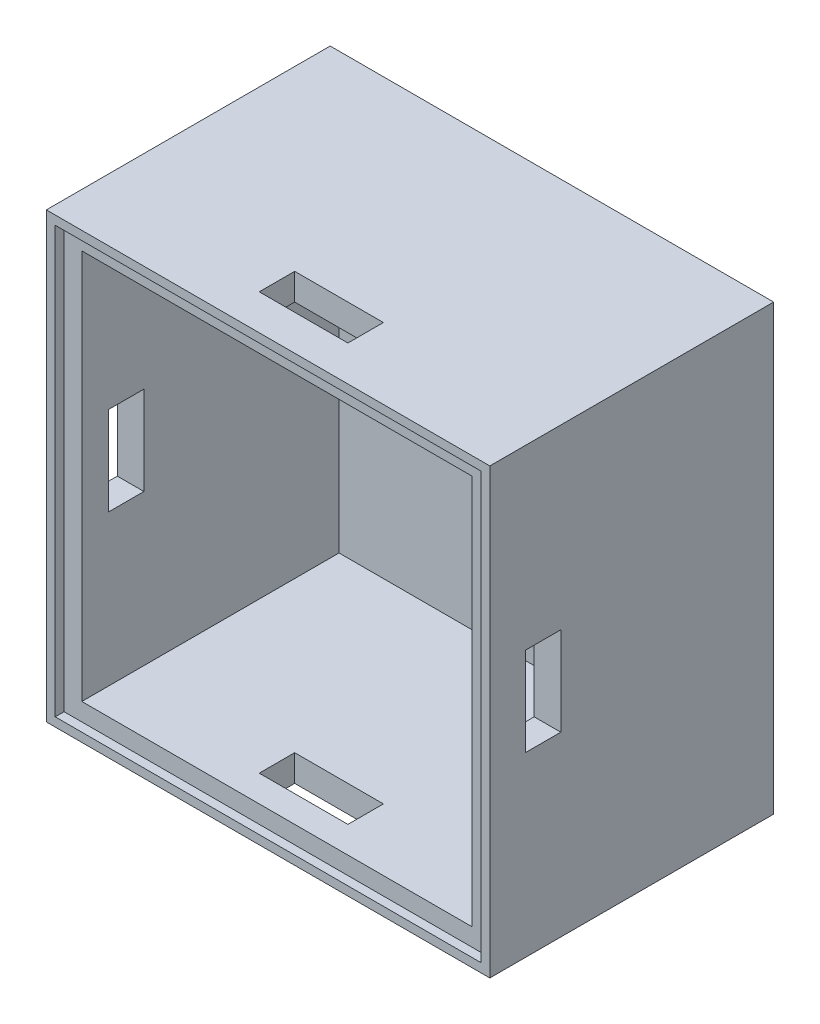
from build123d import *

# Parameters (mm, degrees)
SKETCH_1_W               = 250
SKETCH_1_H               = 250
EXTRUDE_1_DEPTH          = 10
SKETCH_2_W               = 250
SKETCH_2_H               = 250
SKETCH_2_W_2             = 215
SKETCH_2_H_2             = 215
SKETCH_2_W_3             = 100
SKETCH_2_H_3             = 100
EXTRUDE_2_DEPTH          = 5
SKETCH_3_W               = 250
SKETCH_3_H               = 250
EXTRUDE_3_DEPTH          = 150
SKETCH_4_W               = 220
SKETCH_4_H               = 220
CUT_EXTRUDE_1_DEPTH      = 150
CUT_EXTRUDE_2_DEPTH      = 4
SKETCH_6_W               = 20
SKETCH_6_H               = 50
CUT_EXTRUDE_3_DEPTH      = 323.063658392
PATTERN_CIRCULAR_1_COUNT = 2
PATTERN_CIRCULAR_1_ANGLE = 90
SKETCH_11_W              = 240
SKETCH_11_H              = 240
CUT_EXTRUDE_5_DEPTH      = 5
SKETCH_12_OUTSIDE_W      = 330.032
SKETCH_12_OUTSIDE_H      = 330.032
SKETCH_12_OUTSIDE_W_2    = 240
SKETCH_12_OUTSIDE_H_2    = 240
CUT_EXTRUDE_6_DEPTH      = 5


with BuildPart() as part:
    # 스케치1 → 보스-돌출1 (new body)
    with BuildSketch(Plane.XY):
        Rectangle(SKETCH_1_W, SKETCH_1_H)
    extrude(amount=EXTRUDE_1_DEPTH)

    # 스케치2 → 보스-돌출2 (add)
    # profile 1 of 2: a face of its own
    with BuildSketch(Plane(origin=(0, 0, 0), x_dir=(-1, 0, 0), z_dir=(0, 0, -1))):
        Rectangle(SKETCH_2_W, SKETCH_2_H)
        Rectangle(SKETCH_2_W_2, SKETCH_2_H_2, mode=Mode.SUBTRACT)
    # profile 2 of 2: a face of its own
    with BuildSketch(Plane(origin=(0, 0, 0), x_dir=(-1, 0, 0), z_dir=(0, 0, -1))):
        Rectangle(SKETCH_2_W_3, SKETCH_2_H_3)
    extrude(amount=EXTRUDE_2_DEPTH)

    # 스케치3 → 보스-돌출3 (add)
    with BuildSketch(Plane.XY.offset(10)):
        Rectangle(SKETCH_3_W, SKETCH_3_H)
    extrude(amount=EXTRUDE_3_DEPTH)

    # 스케치4 → 컷-돌출1 (cut)
    with BuildSketch(Plane.XY.offset(160)):
        Rectangle(SKETCH_4_W, SKETCH_4_H)
    extrude(amount=-CUT_EXTRUDE_1_DEPTH, mode=Mode.SUBTRACT)

    # 스케치5 → 컷-돌출2 (cut)
    # profile 1 of 5: a face of its own
    with BuildSketch(Plane.ZY.offset(125)):
        with BuildLine():
            Line((77.392628205, 22.435897436), (75.525641026, 22.435897436))
            add(Edge.make_bspline(
                [(75.525641026, 22.435897436), (75.593931724, 22.605833317), (75.72354889, 22.928375151), (75.864489606, 23.404034443), (75.955550979, 23.841342063), (75.968327804, 24.122221436), (75.974358974, 24.254807692)],
                knots=[0, 0, 0, 0, 1.16548392, 2.212112691, 3.15604595, 4, 4, 4, 4], degree=3))
            add(Edge.make_bspline(
                [(75.974358974, 24.254807692), (75.970864839, 24.345752162), (75.964199902, 24.519225488), (75.925218452, 24.769131304), (75.853834802, 24.993592875), (75.753223237, 25.191566325), (75.632624333, 25.356347622), (75.509867583, 25.497978146), (75.371671179, 25.600426101), (75.243075668, 25.656863123), (75.123489273, 25.689205945), (75.002595994, 25.707548077), (74.851509867, 25.723142892), (74.668299902, 25.73379682), (74.456062555, 25.746708668), (74.211586805, 25.754173156), (73.937781357, 25.758109754), (73.744125509, 25.757520417), (73.642628205, 25.757211538)],
                knots=[0, 0, 0, 0, 1.331337761, 2.539479194, 3.689133603, 4.76427039, 5.773050173, 6.672319311, 7.497143179, 8.267115508, 8.712803499, 9.307232687, 10.054035057, 10.93549937, 11.992541252, 13.16587524, 14.514601941, 16, 16, 16, 16], degree=3))
            Line((73.642628205, 25.757211538), (71.615384615, 25.757211538))
            Line((71.615384615, 25.757211538), (71.615384615, 22.692307692))
            Line((71.615384615, 22.692307692), (69.820512821, 22.692307692))
            Line((69.820512821, 22.692307692), (69.820512821, 25.761217949))
            Line((69.820512821, 25.761217949), (57, 25.769230769))
            Line((57, 25.769230769), (57, 27.564102564))
            Line((57, 27.564102564), (69.820512821, 27.564102564))
            Line((69.820512821, 27.564102564), (69.820512821, 29.615384615))
            Line((69.820512821, 29.615384615), (71.615384615, 29.615384615))
            Line((71.615384615, 29.615384615), (71.615384615, 27.564102564))
            Line((71.615384615, 27.564102564), (73.951121795, 27.564102564))
            add(Edge.make_bspline(
                [(73.951121795, 27.564102564), (74.080664429, 27.56327837), (74.329126954, 27.561697568), (74.687354287, 27.551282212), (75.017227229, 27.525938047), (75.318131846, 27.495835015), (75.590657751, 27.454677111), (75.834890799, 27.408937757), (76.050534461, 27.349458077), (76.297741006, 27.258095207), (76.576425073, 27.117370914), (76.87313611, 26.892034316), (77.13488374, 26.617074643), (77.359489756, 26.293858548), (77.543390261, 25.930465861), (77.677961701, 25.527419159), (77.752146306, 25.086860334), (77.763411834, 24.781252008), (77.769230769, 24.623397436)],
                knots=[0, 0, 0, 0, 1.116513312, 2.14147041, 3.087800047, 3.967380394, 4.74708145, 5.462637805, 6.107702186, 6.672153689, 7.732558719, 8.784560146, 9.867280226, 10.991243744, 12.164851891, 13.365962584, 14.639451828, 16, 16, 16, 16], degree=3))
            add(Edge.make_bspline(
                [(77.769230769, 24.623397436), (77.763841125, 24.462947128), (77.752570335, 24.127414448), (77.680318266, 23.600783009), (77.559215325, 23.031360271), (77.449630943, 22.639652757), (77.392628205, 22.435897436)],
                knots=[0, 0, 0, 0, 0.864748747, 1.808357173, 2.859968543, 4, 4, 4, 4], degree=3))
        make_face()
    # profile 2 of 5: a face of its own
    with BuildSketch(Plane.ZY.offset(125)):
        with BuildLine():
            Line((71.615384615, 20.384615385), (71.615384615, 18.58974359))
            Line((71.615384615, 18.58974359), (69.463942308, 18.58974359))
            add(Edge.make_bspline(
                [(69.463942308, 18.58974359), (69.664282285, 18.457252316), (70.047430935, 18.203863785), (70.553840724, 17.782440494), (70.975004156, 17.350905968), (71.306808729, 16.903893527), (71.557336266, 16.445140025), (71.742381372, 15.982273847), (71.849943483, 15.505706569), (71.864501319, 15.184809572), (71.871794872, 15.024038462)],
                knots=[0, 0, 0, 0, 1.280622107, 2.44917983, 3.507334186, 4.490567186, 5.408878616, 6.288712897, 7.142636019, 8, 8, 8, 8], degree=3))
            add(Edge.make_bspline(
                [(71.871794872, 15.024038462), (71.865144055, 14.899276185), (71.851528837, 14.643869132), (71.751080843, 14.256062761), (71.596795289, 13.854855829), (71.448158055, 13.595948984), (71.37099359, 13.461538462)],
                knots=[0, 0, 0, 0, 0.90119973, 1.844890732, 2.881183062, 4, 4, 4, 4], degree=3))
            Line((71.37099359, 13.461538462), (69.81650641, 14.447115385))
            add(Edge.make_bspline(
                [(69.81650641, 14.447115385), (69.855022217, 14.533452648), (69.92813259, 14.697337303), (70.014658363, 14.937077681), (70.065606453, 15.158113891), (70.073324839, 15.298934225), (70.076923077, 15.364583333)],
                knots=[0, 0, 0, 0, 1.180555205, 2.24091978, 3.179933427, 4, 4, 4, 4], degree=3))
            add(Edge.make_bspline(
                [(70.076923077, 15.364583333), (70.067675851, 15.510063447), (70.048982662, 15.804150276), (69.89155254, 16.235294557), (69.647893428, 16.655556662), (69.368048526, 16.985070719), (69.103363598, 17.242163185), (68.870963309, 17.425728296), (68.61054919, 17.594227693), (68.326369318, 17.755192648), (68.013630332, 17.901859443), (67.675439676, 18.038742615), (67.311410616, 18.162507732), (67.05779618, 18.23308053), (66.927884615, 18.269230769)],
                knots=[0, 0, 0, 0, 1.135927944, 2.296268816, 3.551388088, 4.924624343, 5.663947748, 6.437790805, 7.238014523, 8.089896346, 8.992356783, 9.939655789, 10.944608424, 12, 12, 12, 12], degree=3))
            add(Edge.make_bspline(
                [(66.927884615, 18.269230769), (66.812015052, 18.296273017), (66.555372774, 18.356169541), (66.124809776, 18.4144069), (65.616103154, 18.471947003), (65.027836909, 18.512499108), (64.361480087, 18.55008792), (63.61601754, 18.57128839), (62.790684105, 18.589020621), (62.213687801, 18.589495289), (61.911858974, 18.58974359)],
                knots=[0, 0, 0, 0, 0.566838948, 1.255505196, 2.06880316, 3.007127437, 4.065329342, 5.249902469, 6.561414163, 8, 8, 8, 8], degree=3))
            Line((61.911858974, 18.58974359), (57, 18.58974359))
            Line((57, 18.58974359), (57, 20.384615385))
            Line((57, 20.384615385), (71.615384615, 20.384615385))
        make_face()
    # profile 3 of 5: a face of its own
    with BuildSketch(Plane.ZY.offset(125)):
        with BuildLine():
            add(Edge.make_bspline(
                [(71.871794872, 4.350961538), (71.86597263, 4.076718886), (71.854556638, 3.538996066), (71.731942742, 2.751618832), (71.546006599, 2.000797533), (71.284277289, 1.283311371), (70.940878213, 0.605095405), (70.525606541, -0.039905718), (70.035652736, -0.650399709), (69.656431846, -1.016230333), (69.463942308, -1.201923077)],
                knots=[0, 0, 0, 0, 1.054042676, 2.066720093, 3.05716247, 4.025731183, 4.997454851, 5.974904663, 6.97207755, 8, 8, 8, 8], degree=3))
            add(Edge.make_bspline(
                [(69.463942308, -1.201923077), (69.279862389, -1.361819957), (68.915265005, -1.678519273), (68.324090074, -2.084609095), (67.711860927, -2.434446581), (67.070447632, -2.714806358), (66.405449511, -2.935863636), (65.714580876, -3.092810472), (64.999367464, -3.186164386), (64.513631246, -3.198752769), (64.267628205, -3.205128205)],
                knots=[0, 0, 0, 0, 1.025258237, 2.030674902, 3.01204498, 3.988269485, 4.97094183, 5.956517959, 6.965070386, 8, 8, 8, 8], degree=3))
            add(Edge.make_bspline(
                [(64.267628205, -3.205128205), (64.020199304, -3.199520563), (63.531268255, -3.188439602), (62.811157599, -3.083618934), (62.112901449, -2.920584167), (61.439423276, -2.687259343), (60.788663974, -2.388070278), (60.163467649, -2.022980137), (59.562594085, -1.589429955), (58.991171405, -1.09797112), (58.464446169, -0.554845233), (58.005648945, 0.034490181), (57.610925984, 0.658880917), (57.297406201, 1.326850528), (57.04468742, 2.028890677), (56.870421556, 2.76946678), (56.76411465, 3.54791818), (56.750527617, 4.079515073), (56.743589744, 4.350961538)],
                knots=[0, 0, 0, 0, 0.998669827, 1.973418153, 2.932281609, 3.89081133, 4.846438734, 5.82045571, 6.809776312, 7.834649874, 8.860672198, 9.859676908, 10.845817165, 11.837296335, 12.833502054, 13.853824644, 14.904110009, 16, 16, 16, 16], degree=3))
            add(Edge.make_bspline(
                [(56.743589744, 4.350961538), (56.750585021, 4.623724876), (56.764285625, 5.157945651), (56.869630784, 5.939328249), (57.046549378, 6.683022409), (57.294277597, 7.38838337), (57.613501137, 8.056350273), (58.004113114, 8.683046581), (58.464678494, 9.272659973), (58.991108455, 9.81595614), (59.562610304, 10.307369319), (60.163463439, 10.740931282), (60.788665071, 11.106018363), (61.439422983, 11.40520823), (62.112901527, 11.63853284), (62.811157578, 11.801567665), (63.531268261, 11.906388317), (64.020199306, 11.91746928), (64.267628205, 11.923076923)],
                knots=[0, 0, 0, 0, 1.099861214, 2.154133753, 3.1731438, 4.178222029, 5.163564916, 6.153006591, 7.15072618, 8.175428628, 9.198983792, 10.187031731, 11.15979573, 12.114193814, 13.071490482, 14.029120454, 15.002614863, 16, 16, 16, 16], degree=3))
            add(Edge.make_bspline(
                [(64.267628205, 11.923076923), (64.512294182, 11.916658007), (64.996690767, 11.903949656), (65.710559685, 11.810689604), (66.400259051, 11.654354995), (67.062690342, 11.43303273), (67.701292834, 11.150088782), (68.315034725, 10.805167137), (68.903536442, 10.394934951), (69.267662614, 10.079495228), (69.451923077, 9.919871795)],
                knots=[0, 0, 0, 0, 1.031353054, 2.041901799, 3.029428768, 4.008703097, 4.981709435, 5.96992636, 6.972712378, 8, 8, 8, 8], degree=3))
            add(Edge.make_bspline(
                [(69.451923077, 9.919871795), (69.646049508, 9.734443636), (70.027833292, 9.369766534), (70.516820395, 8.756454414), (70.937690927, 8.114227864), (71.280917183, 7.431637172), (71.545531712, 6.712155987), (71.732810563, 5.955754434), (71.854014284, 5.165511305), (71.865808943, 4.625184031), (71.871794872, 4.350961538)],
                knots=[0, 0, 0, 0, 1.027951202, 2.021646915, 2.998468564, 3.9668038, 4.943370589, 5.93035926, 6.949632805, 8, 8, 8, 8], degree=3))
        make_face()
        with BuildLine():
            add(Edge.make_bspline(
                [(70.076923077, 4.358974359), (70.071410827, 4.552903349), (70.060528624, 4.935755083), (69.977767754, 5.499298709), (69.846623257, 6.041802254), (69.660372991, 6.564364204), (69.419586541, 7.064963467), (69.125507986, 7.544150846), (68.776571035, 8.000638936), (68.379711139, 8.430920925), (67.948651696, 8.830448917), (67.485131104, 9.175672553), (67.002446867, 9.469764635), (66.498093491, 9.714503898), (65.967294515, 9.896847287), (65.415972602, 10.029260054), (64.843028451, 10.11194836), (64.453536769, 10.122727499), (64.255608974, 10.128205128)],
                knots=[0, 0, 0, 0, 1.021589593, 2.016807015, 2.994807536, 3.958602519, 4.934347097, 5.916793557, 6.916107818, 7.957073844, 8.998039869, 10.008589932, 10.997041759, 11.972786337, 12.956492182, 13.948170289, 14.957322718, 16, 16, 16, 16], degree=3))
            add(Edge.make_bspline(
                [(64.255608974, 10.128205128), (63.999871804, 10.119047508), (63.492281343, 10.100871344), (62.744955389, 9.95231371), (62.02615269, 9.705552557), (61.344527821, 9.365285456), (60.712770513, 8.946236285), (60.144691363, 8.456244221), (59.66219778, 7.888534956), (59.256412552, 7.26244008), (58.936857067, 6.586832151), (58.707693292, 5.873038026), (58.560728608, 5.127557016), (58.545948854, 4.617410753), (58.538461538, 4.358974359)],
                knots=[0, 0, 0, 0, 1.016977094, 2.018509362, 3.018404954, 4.033172147, 5.041280572, 6.028085189, 7.007940189, 7.995502847, 8.989109012, 9.972200833, 10.97273166, 12, 12, 12, 12], degree=3))
            add(Edge.make_bspline(
                [(58.538461538, 4.358974359), (58.545905483, 4.1005231), (58.560599622, 3.590347493), (58.708437864, 2.843829241), (58.935860583, 2.128078835), (59.256773472, 1.451768447), (59.660664018, 0.825388446), (60.147440084, 0.261733015), (60.711277137, -0.232478794), (61.343690154, -0.651942901), (62.02721236, -0.986727357), (62.744822944, -1.234648956), (63.492315073, -1.382850307), (63.999883105, -1.401074561), (64.255608974, -1.41025641)],
                knots=[0, 0, 0, 0, 1.027082318, 2.027431966, 3.015401697, 4.008827937, 4.996211763, 5.971861488, 6.96198607, 7.969911943, 8.982141629, 9.981856156, 10.983207064, 12, 12, 12, 12], degree=3))
            add(Edge.make_bspline(
                [(64.255608974, -1.41025641), (64.453552573, -1.404819537), (64.843075355, -1.394120601), (65.415793302, -1.31084894), (65.968384955, -1.180493079), (66.495954405, -0.990164823), (67.004910157, -0.753825154), (67.483681682, -0.452578942), (67.94894636, -0.108963287), (68.379451325, 0.291297828), (68.778021071, 0.721531376), (69.124236886, 1.181448856), (69.419754478, 1.660858783), (69.660402645, 2.161616248), (69.845906375, 2.682995666), (69.978339039, 3.223852141), (70.060226869, 3.784900128), (70.071322079, 4.166392388), (70.076923077, 4.358974359)],
                knots=[0, 0, 0, 0, 1.043020522, 2.052505155, 3.044509714, 4.030878336, 5.003918577, 5.996372628, 7.007255355, 8.048564058, 9.08987276, 10.095126797, 11.077896669, 12.053962454, 13.01807471, 13.98956039, 14.985105429, 16, 16, 16, 16], degree=3))
        make_face(mode=Mode.SUBTRACT)
    # profile 4 of 5: a face of its own
    with BuildSketch(Plane.ZY.offset(125)):
        with BuildLine():
            Line((71.615384615, -6.794871795), (71.615384615, -8.58974359))
            Line((71.615384615, -8.58974359), (68.979166667, -8.58974359))
            add(Edge.make_bspline(
                [(68.979166667, -8.58974359), (69.21826794, -8.781387219), (69.682252303, -9.153278368), (70.292084157, -9.772617415), (70.794628301, -10.427153988), (71.195221409, -11.112879723), (71.49720213, -11.830725495), (71.715293164, -12.576315609), (71.846063613, -13.354113929), (71.863150644, -13.883053569), (71.871794872, -14.150641026)],
                knots=[0, 0, 0, 0, 1.12780773, 2.188550248, 3.19190651, 4.159438251, 5.104880172, 6.052711206, 7.014878035, 8, 8, 8, 8], degree=3))
            add(Edge.make_bspline(
                [(71.871794872, -14.150641026), (71.86180749, -14.421094484), (71.842259774, -14.950437139), (71.688087819, -15.721271931), (71.423224246, -16.441847087), (71.06407524, -17.110584087), (70.615045375, -17.712115522), (70.089115921, -18.235611167), (69.488806618, -18.672284827), (68.930178878, -18.964625875), (68.434844454, -19.157374782), (68.010570254, -19.278695179), (67.53789726, -19.381731572), (67.018241805, -19.471055168), (66.447966632, -19.531496013), (65.829408332, -19.579166189), (65.162767604, -19.613330174), (64.701701159, -19.61468564), (64.463942308, -19.615384615)],
                knots=[0, 0, 0, 0, 1.235764744, 2.418689688, 3.575570385, 4.733739044, 5.876600945, 6.994686206, 8.113221397, 9.257403329, 9.866223892, 10.540462211, 11.272173464, 12.077110251, 12.949508505, 13.892531187, 14.913238277, 16, 16, 16, 16], degree=3))
            Line((64.463942308, -19.615384615), (57, -19.615384615))
            Line((57, -19.615384615), (57, -17.820512821))
            Line((57, -17.820512821), (63.875, -17.820512821))
            add(Edge.make_bspline(
                [(63.875, -17.820512821), (64.0739854, -17.819408775), (64.454610604, -17.817296923), (64.999576451, -17.810636085), (65.49378547, -17.794580047), (65.936056141, -17.772018259), (66.325963779, -17.738995227), (66.664302503, -17.704580191), (66.950642745, -17.662494609), (67.123014645, -17.624992249), (67.200320513, -17.608173077)],
                knots=[0, 0, 0, 0, 1.430800155, 2.736877192, 3.918605307, 4.986035426, 5.920637409, 6.731861385, 7.431261377, 8, 8, 8, 8], degree=3))
            add(Edge.make_bspline(
                [(67.200320513, -17.608173077), (67.42724157, -17.547455754), (67.863994396, -17.430593693), (68.456419268, -17.141828075), (68.960408913, -16.777175614), (69.372847322, -16.332045046), (69.693823532, -15.810736042), (69.916531845, -15.214695226), (70.055824812, -14.549674422), (70.069694137, -14.081935093), (70.076923077, -13.838141026)],
                knots=[0, 0, 0, 0, 1.084156227, 2.086665306, 3.027808233, 3.945421172, 4.874247719, 5.839848303, 6.874090471, 8, 8, 8, 8], degree=3))
            add(Edge.make_bspline(
                [(70.076923077, -13.838141026), (70.074204063, -13.693753757), (70.068823205, -13.408015082), (70.014801019, -12.984308329), (69.926522284, -12.57328545), (69.807069043, -12.170986034), (69.644518359, -11.785943917), (69.456363734, -11.406907158), (69.225961795, -11.044723101), (68.967793271, -10.692541583), (68.680071244, -10.365276869), (68.380915763, -10.056402832), (68.057732298, -9.78502364), (67.721965056, -9.538685873), (67.366864558, -9.326299706), (66.996227834, -9.140837132), (66.609468296, -8.98349468), (66.341039965, -8.905307279), (66.206730769, -8.866185897)],
                knots=[0, 0, 0, 0, 1.02388931, 2.02625049, 3.024079426, 4.004119353, 4.998163158, 5.985366248, 7.002659681, 8.039138713, 9.080111048, 10.09169763, 11.086418407, 12.069932368, 13.043171485, 14.017654831, 15.008125612, 16, 16, 16, 16], degree=3))
            add(Edge.make_bspline(
                [(66.206730769, -8.866185897), (66.108129609, -8.84367362), (65.893480041, -8.794665569), (65.541226216, -8.741733113), (65.133740644, -8.693689825), (64.671498833, -8.653478633), (64.152882403, -8.628876253), (63.580106187, -8.602051129), (62.950886254, -8.592285065), (62.512819438, -8.590614471), (62.284455128, -8.58974359)],
                knots=[0, 0, 0, 0, 0.615963638, 1.340920617, 2.168419149, 3.115676021, 4.16674242, 5.331190069, 6.6087489, 8, 8, 8, 8], degree=3))
            Line((62.284455128, -8.58974359), (57, -8.58974359))
            Line((57, -8.58974359), (57, -6.794871795))
            Line((57, -6.794871795), (71.615384615, -6.794871795))
        make_face()
    # profile 5 of 5: a face of its own
    with BuildSketch(Plane.ZY.offset(125)):
        Polygon((77.512820513, -25.512820513), (77.512820513, -27.307692308), (71.615384615, -27.307692308), (71.615384615, -29.871794872), (69.820512821, -29.871794872), (69.820512821, -27.307692308), (57, -27.307692308), (57, -25.512820513), (69.820512821, -25.512820513), (69.820512821, -22.948717949), (71.615384615, -22.948717949), (71.615384615, -25.512820513), align=None)
    extrude(amount=-CUT_EXTRUDE_2_DEPTH, mode=Mode.SUBTRACT)

    # 스케치6 → 컷-돌출3 (cut, through all)
    with BuildSketch(Plane.ZY.offset(125)):
        with Locations((130, 0)):
            Rectangle(SKETCH_6_W, SKETCH_6_H)
    cut_extrude_3 = extrude(amount=-CUT_EXTRUDE_3_DEPTH, mode=Mode.SUBTRACT)

    # 원형 패턴1: 컷-돌출3 ×2 about axis
    pattern_circular_1_axis = Axis((0, 0, 0), (0, 0, -1))
    for i in range(1, PATTERN_CIRCULAR_1_COUNT):
        add(cut_extrude_3.rotate(pattern_circular_1_axis, i * PATTERN_CIRCULAR_1_ANGLE / (PATTERN_CIRCULAR_1_COUNT - 1)), mode=Mode.SUBTRACT)

    # 스케치11 → 컷-돌출5 (cut)
    with BuildSketch(Plane.XY.offset(160)):
        Rectangle(SKETCH_11_W, SKETCH_11_H)
    extrude(amount=-CUT_EXTRUDE_5_DEPTH, mode=Mode.SUBTRACT)

    # 스케치12 outside → 컷-돌출6 (cut)
    with BuildSketch(Plane(origin=(0, 0, -5), x_dir=(-1, 0, 0), z_dir=(0, 0, -1))):
        Rectangle(SKETCH_12_OUTSIDE_W, SKETCH_12_OUTSIDE_H)
        Rectangle(SKETCH_12_OUTSIDE_W_2, SKETCH_12_OUTSIDE_H_2, mode=Mode.SUBTRACT)
    extrude(amount=-CUT_EXTRUDE_6_DEPTH, mode=Mode.SUBTRACT)


solid = part.part
